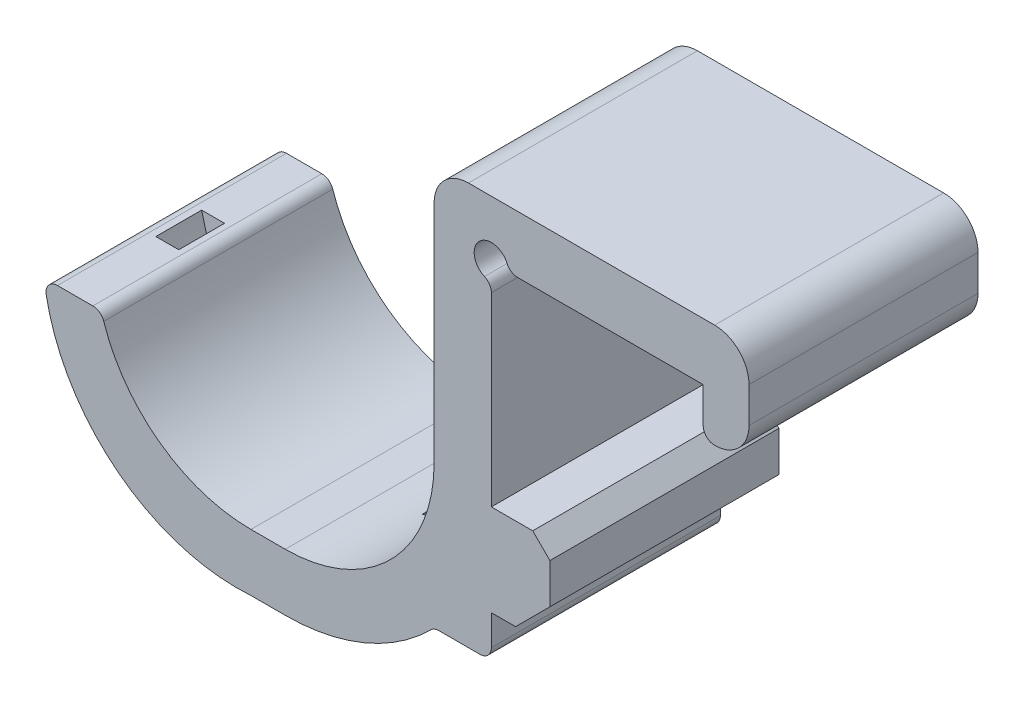
from build123d import *

# Parameters (mm, degrees)
BOSS_EXTRUDE1_DEPTH     = 20
FILLET1_R               = 3
CHAMFER1_SIZE           = 3
FILLET2_R               = 1
CUT_EXTRUDE1_DEPTH      = 2
CUT_EXTRUDE1_DEPTH_BACK = 2
CUT_EXTRUDE1_START      = -10
CHAMFER2_SIZE           = 1.5


with BuildPart() as part:
    # Sketch1 → Boss-Extrude1 (new body)
    with BuildSketch(Plane.XY):
        with BuildLine():
            Line((18, 45.5), (18, 41.407980081))
            Line((18, 41.407980081), (22, 41.407980081))
            Line((22, 41.407980081), (22, 50.5))
            Line((22, 50.5), (-5.5, 50.5))
            Line((-5.5, 50.5), (-5.5, 27.798635693))
            ThreePointArc((-5.5, 27.798635693), (-9.307611845, 18.606247538), (-18.5, 14.798635693))
            Line((-18.5, 14.798635693), (-21.5, 14.798635693))
            ThreePointArc((-21.5, 14.798635693), (-29.723519433, 17.585816031), (-34.557759664, 24.798635693))
            Line((-34.557759664, 24.798635693), (-39.557759664, 24.798635693))
            ThreePointArc((-39.557759664, 24.798635693), (-33.539294452, 13.674546113), (-21.5, 9.798635693))
            Line((-21.5, 9.798635693), (-18.5, 9.798635693))
            ThreePointArc((-18.5, 9.798635693), (-11.432404679, 11.244207392), (-5.5, 15.348736095))
            Line((-5.5, 15.348736095), (-0.5, 15.348736095))
            Line((-0.5, 15.348736095), (-0.5, 19))
            Line((-0.5, 19), (4.612884421, 19))
            Line((4.612884421, 19), (4.612884421, 27))
            Line((4.612884421, 27), (-0.5, 27))
            Line((-0.5, 27), (-0.5, 44))
            ThreePointArc((-0.5, 44), (-1.560660172, 46.560660172), (1, 45.5))
            Line((1, 45.5), (18, 45.5))
        make_face()
    extrude(amount=-BOSS_EXTRUDE1_DEPTH)

    # Fillet1
    fillet1_edges = [part.edges().sort_by_distance(p)[0] for p in [
        (-5.5, 50.5, -10),
        (22, 50.5, -10),
        (22, 41.407980081, -10),
    ]]
    fillet(fillet1_edges, radius=FILLET1_R)

    # Chamfer1
    chamfer1_edges = [part.edges().sort_by_distance(p)[0] for p in [
        (4.612884421, 19, -10),
    ]]
    chamfer(chamfer1_edges, length=CHAMFER1_SIZE)

    # Fillet2
    fillet2_edges = [part.edges().sort_by_distance(p)[0] for p in [
        (18, 41.407980081, -10),
        (-0.5, 15.348736095, -10),
        (-5.5, 15.348736095, -10),
        (-34.557759664, 24.798635693, -10),
        (-39.557759664, 24.798635693, -10),
        (-0.5, 44, -10),
        (1, 45.5, -10),
    ]]
    fillet(fillet2_edges, radius=FILLET2_R - 0.0001)  # a hair under: the kernel refuses the full size

    # Sketch3 → Cut-Extrude1 (cut, two sides: drawn at the far end of the back side and taken through both)
    with BuildSketch(Plane.XY.offset(CUT_EXTRUDE1_START - CUT_EXTRUDE1_DEPTH_BACK)):
        with BuildLine():
            Line((-18.5, 13.593483966), (-21.5, 13.593483966))
            ThreePointArc((-21.5, 13.593483966), (-30.584504262, 16.728345827), (-35.80235804, 24.798635693))
            Line((-35.80235804, 24.798635693), (-37.80235804, 24.798635693))
            ThreePointArc((-37.80235804, 24.798635693), (-31.973681851, 15.343278195), (-21.5, 11.644732532))
            Line((-21.5, 11.644732532), (-18.5, 11.644732532))
            ThreePointArc((-18.5, 11.644732532), (-4.080428513, 20.516840208), (-5.5, 37.387618296))
            Line((-5.5, 37.387618296), (-5.5, 33.524571041))
            ThreePointArc((-5.5, 33.524571041), (-4.487181784, 30.128284006), (-4.346617542, 26.586983672))
            ThreePointArc((-4.346617542, 26.586983672), (-4.771973785, 24.147932767), (-5.614362182, 21.819783493))
            ThreePointArc((-5.614362182, 21.819783493), (-7.568289903, 18.727580078), (-10.247050758, 16.236838064))
            ThreePointArc((-10.247050758, 16.236838064), (-12.457076385, 14.94292063), (-14.8635084, 14.066838125))
            ThreePointArc((-14.8635084, 14.066838125), (-16.666415033, 13.712319575), (-18.5, 13.593483966))
        make_face()
        with BuildLine():
            Line((-6.471563344, 22.867437906), (-5.614362182, 21.819783493))
            ThreePointArc((-5.614362182, 21.819783493), (-4.771973785, 24.147932767), (-4.346617542, 26.586983672))
            Line((-4.346617542, 26.586983672), (-5.5, 27.996625043))
            Line((-5.5, 27.996625043), (-5.5, 27.798635693))
            ThreePointArc((-5.5, 27.798635693), (-5.745203323, 25.285637139), (-6.471563344, 22.867437906))
        make_face()
        with BuildLine():
            Line((-14.54802471, 15.413891396), (-14.8635084, 14.066838125))
            ThreePointArc((-14.8635084, 14.066838125), (-12.457076385, 14.94292063), (-10.247050758, 16.236838064))
            Line((-10.247050758, 16.236838064), (-9.8019978, 18.137126612))
            ThreePointArc((-9.8019978, 18.137126612), (-12.030109342, 16.522975408), (-14.54802471, 15.413891396))
        make_face()
    extrude(amount=CUT_EXTRUDE1_DEPTH + CUT_EXTRUDE1_DEPTH_BACK, mode=Mode.SUBTRACT)

    # Chamfer2
    chamfer2_edges = [part.edges().sort_by_distance(p)[0] for p in [
        (4.612884421, 27, -10),
    ]]
    chamfer(chamfer2_edges, length=CHAMFER2_SIZE)


solid = part.part
